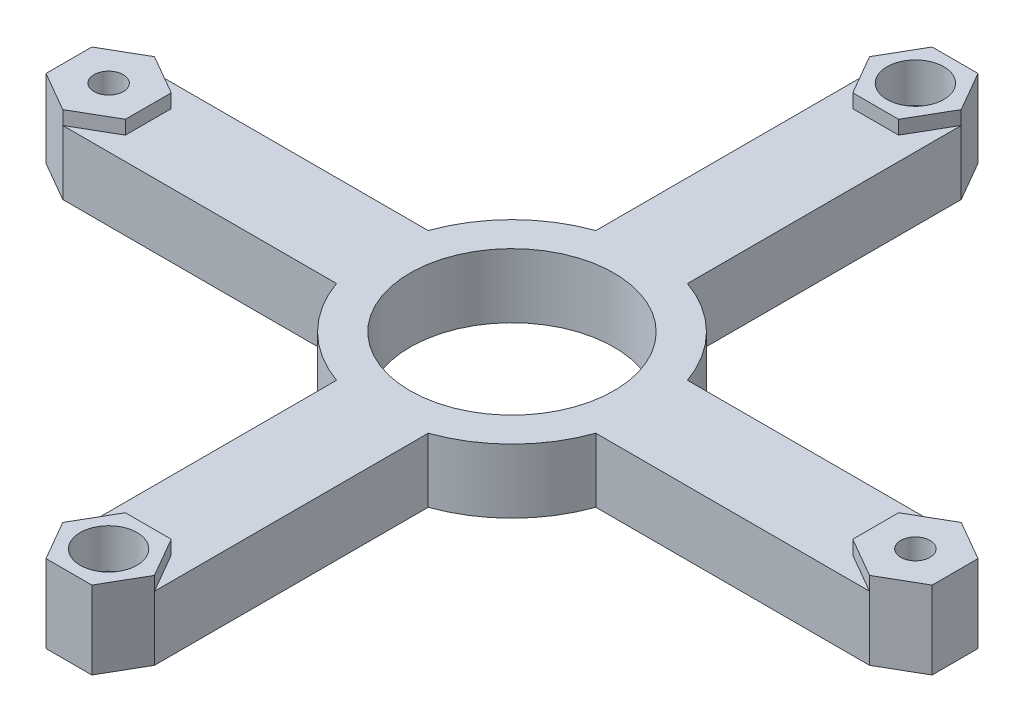
from build123d import *

# Parameters (mm, degrees)
SKETCH1_R           = 11.125
SKETCH1_R_2         = 1.6
BOSS_EXTRUDE1_DEPTH = 7
SKETCH3_R           = 3.1
CUT_EXTRUDE1_DEPTH  = 2.8
SKETCH2_R           = 1.6
SKETCH2_R_2         = 3.1
BOSS_EXTRUDE2_DEPTH = 1.5


with BuildPart() as part:
    # Sketch1 → Boss-Extrude1 (new body)
    with BuildSketch(Plane(origin=(0, 0, 0), x_dir=(1, 0, 0), z_dir=(0, 1, 0))):
        with BuildLine():
            Line((44, 5), (48.330127019, 2.5))
            Line((48.330127019, 2.5), (48.330127019, -2.5))
            Line((48.330127019, -2.5), (44, -5))
            Line((44, -5), (14.142135624, -5))
            ThreePointArc((14.142135624, -5), (10.606601718, -10.606601718), (5, -14.142135624))
            Line((5, -14.142135624), (5, -44))
            Line((5, -44), (2.5, -48.330127019))
            Line((2.5, -48.330127019), (-2.5, -48.330127019))
            Line((-2.5, -48.330127019), (-5, -44))
            Line((-5, -44), (-5, -14.142135624))
            ThreePointArc((-5, -14.142135624), (-10.606601718, -10.606601718), (-14.142135624, -5))
            Line((-14.142135624, -5), (-44, -5))
            Line((-44, -5), (-48.330127019, -2.5))
            Line((-48.330127019, -2.5), (-48.330127019, 2.5))
            Line((-48.330127019, 2.5), (-44, 5))
            Line((-44, 5), (-14.142135624, 5))
            ThreePointArc((-14.142135624, 5), (-10.606601718, 10.606601718), (-5, 14.142135624))
            Line((-5, 14.142135624), (-5, 44))
            Line((-5, 44), (-2.5, 48.330127019))
            Line((-2.5, 48.330127019), (2.5, 48.330127019))
            Line((2.5, 48.330127019), (5, 44))
            Line((5, 44), (5, 14.142135624))
            ThreePointArc((5, 14.142135624), (10.606601718, 10.606601718), (14.142135624, 5))
            Line((14.142135624, 5), (44, 5))
        make_face()
        Circle(SKETCH1_R, mode=Mode.SUBTRACT)
        with Locations((44, 0)):
            Circle(SKETCH1_R_2, mode=Mode.SUBTRACT)
        with Locations((0, 44)):
            Circle(SKETCH1_R_2, mode=Mode.SUBTRACT)
        with Locations((-44, 0)):
            Circle(SKETCH1_R_2, mode=Mode.SUBTRACT)
        with Locations((0, -44)):
            Circle(SKETCH1_R_2, mode=Mode.SUBTRACT)
    extrude(amount=BOSS_EXTRUDE1_DEPTH)

    # Sketch3 → Cut-Extrude1 (cut)
    with BuildSketch(Plane(origin=(0, 7, 0), x_dir=(1, 0, 0), z_dir=(0, 1, 0))):
        with Locations((0, 44)):
            Circle(SKETCH3_R)
        with Locations((0, -44)):
            Circle(SKETCH3_R)
    extrude(amount=-CUT_EXTRUDE1_DEPTH, mode=Mode.SUBTRACT)

    # Sketch2 → Boss-Extrude2 (add)
    # profile 1 of 4: a face of its own
    with BuildSketch(Plane(origin=(0, 7, 0), x_dir=(1, 0, 0), z_dir=(0, 1, 0))):
        Polygon((-44, 5), (-48.330127019, 2.5), (-48.330127019, -2.5), (-44, -5), (-39.669872981, -2.5), (-39.669872981, 2.5), align=None)
        with Locations((-44, 0)):
            Circle(SKETCH2_R, mode=Mode.SUBTRACT)
    # profile 2 of 4: a face of its own
    with BuildSketch(Plane(origin=(0, 7, 0), x_dir=(1, 0, 0), z_dir=(0, 1, 0))):
        Polygon((48.330127019, 2.5), (44, 5), (39.669872981, 2.5), (39.669872981, -2.5), (44, -5), (48.330127019, -2.5), align=None)
        with Locations((44, 0)):
            Circle(SKETCH2_R, mode=Mode.SUBTRACT)
    # profile 3 of 4: a face of its own
    with BuildSketch(Plane(origin=(0, 7, 0), x_dir=(1, 0, 0), z_dir=(0, 1, 0))):
        Polygon((2.5, 48.330127019), (-2.5, 48.330127019), (-5, 44), (-2.5, 39.669872981), (2.5, 39.669872981), (5, 44), align=None)
        with Locations((0, 44)):
            Circle(SKETCH2_R_2, mode=Mode.SUBTRACT)
    # profile 4 of 4: a face of its own
    with BuildSketch(Plane(origin=(0, 7, 0), x_dir=(1, 0, 0), z_dir=(0, 1, 0))):
        Polygon((-2.5, -48.330127019), (2.5, -48.330127019), (5, -44), (2.5, -39.669872981), (-2.5, -39.669872981), (-5, -44), align=None)
        with Locations((0, -44)):
            Circle(SKETCH2_R_2, mode=Mode.SUBTRACT)
    extrude(amount=BOSS_EXTRUDE2_DEPTH)


solid = part.part
